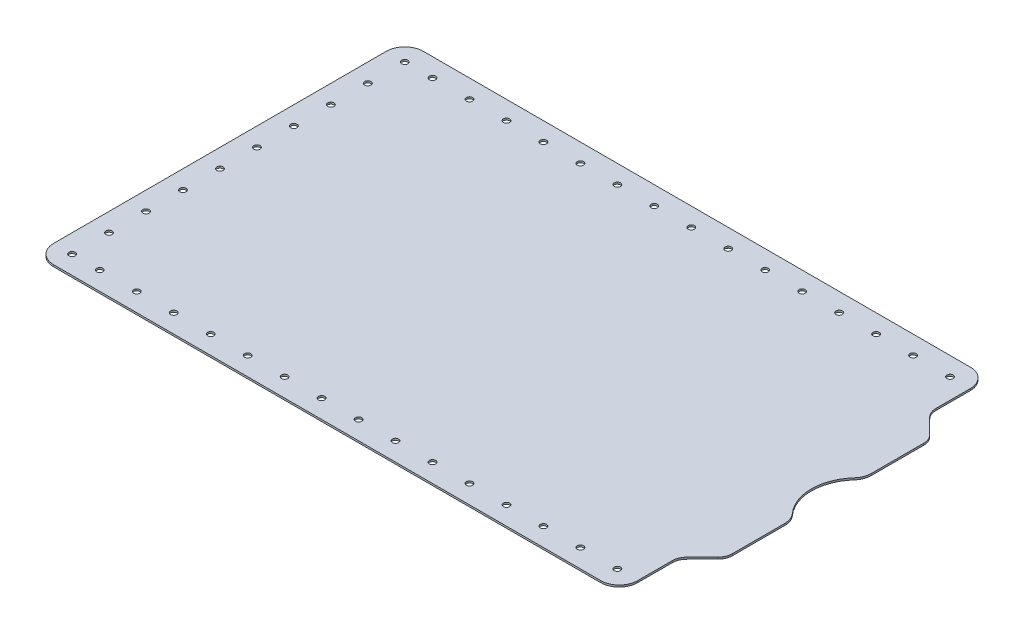
from build123d import *

# Parameters (mm, degrees)
SKETCH1_W                      = 329
SKETCH1_H                      = 200
BOSS_EXTRUDE1_DEPTH            = 1
CUT_EXTRUDE1_DEPTH             = 193.512986575
FILLET1_R                      = 8
FILLET2_R                      = 10
SKETCH3_R                      = 1.7
CUT_EXTRUDE2_DEPTH             = 193.512986575
M3_CLEARANCE_HOLE1_AT_2_COUNT  = 2
M3_CLEARANCE_HOLE1_AT_2_PITCH  = 20
M3_CLEARANCE_HOLE1_AT_3_COUNT  = 2
M3_CLEARANCE_HOLE1_AT_3_PITCH  = 40
M3_CLEARANCE_HOLE1_AT_4_COUNT  = 2
M3_CLEARANCE_HOLE1_AT_4_PITCH  = 60
M3_CLEARANCE_HOLE1_AT_5_COUNT  = 2
M3_CLEARANCE_HOLE1_AT_5_PITCH  = 80
M3_CLEARANCE_HOLE1_AT_6_COUNT  = 2
M3_CLEARANCE_HOLE1_AT_6_PITCH  = 100
M3_CLEARANCE_HOLE1_AT_7_COUNT  = 2
M3_CLEARANCE_HOLE1_AT_7_PITCH  = 120
M3_CLEARANCE_HOLE2_AT_2_COUNT  = 2
M3_CLEARANCE_HOLE2_AT_2_PITCH  = 20
M3_CLEARANCE_HOLE2_AT_3_COUNT  = 2
M3_CLEARANCE_HOLE2_AT_3_PITCH  = 40
M3_CLEARANCE_HOLE2_AT_4_COUNT  = 2
M3_CLEARANCE_HOLE2_AT_4_PITCH  = 60
M3_CLEARANCE_HOLE2_AT_5_COUNT  = 2
M3_CLEARANCE_HOLE2_AT_5_PITCH  = 80
M3_CLEARANCE_HOLE2_AT_6_COUNT  = 2
M3_CLEARANCE_HOLE2_AT_6_PITCH  = 100
M3_CLEARANCE_HOLE2_AT_7_COUNT  = 2
M3_CLEARANCE_HOLE2_AT_7_PITCH  = 120
M3_CLEARANCE_HOLE2_AT_8_COUNT  = 2
M3_CLEARANCE_HOLE2_AT_8_PITCH  = 140
M3_CLEARANCE_HOLE2_AT_9_COUNT  = 2
M3_CLEARANCE_HOLE2_AT_9_PITCH  = 160
M3_CLEARANCE_HOLE2_AT_10_COUNT = 2
M3_CLEARANCE_HOLE2_AT_10_PITCH = 180
M3_CLEARANCE_HOLE2_AT_11_COUNT = 2
M3_CLEARANCE_HOLE2_AT_11_PITCH = 200
M3_CLEARANCE_HOLE2_AT_12_COUNT = 2
M3_CLEARANCE_HOLE2_AT_12_PITCH = 220
M3_CLEARANCE_HOLE2_AT_13_COUNT = 2
M3_CLEARANCE_HOLE2_AT_13_PITCH = 240
M3_CLEARANCE_HOLE2_AT_14_COUNT = 2
M3_CLEARANCE_HOLE2_AT_14_PITCH = 260
M3_CLEARANCE_HOLE2_AT_15_COUNT = 2
M3_CLEARANCE_HOLE2_AT_15_PITCH = 280
M3_CLEARANCE_HOLE2_AT_16_COUNT = 2
M3_CLEARANCE_HOLE2_AT_16_PITCH = 332.866339542
M3_CLEARANCE_HOLE2_AT_17_COUNT = 2
M3_CLEARANCE_HOLE2_AT_17_PITCH = 316.227766017
M3_CLEARANCE_HOLE2_AT_18_COUNT = 2
M3_CLEARANCE_HOLE2_AT_18_PITCH = 300
M3_CLEARANCE_HOLE2_AT_19_COUNT = 2
M3_CLEARANCE_HOLE2_AT_19_PITCH = 284.253408071
M3_CLEARANCE_HOLE2_AT_20_COUNT = 2
M3_CLEARANCE_HOLE2_AT_20_PITCH = 269.072480941
M3_CLEARANCE_HOLE2_AT_21_COUNT = 2
M3_CLEARANCE_HOLE2_AT_21_PITCH = 254.558441227
M3_CLEARANCE_HOLE2_AT_22_COUNT = 2
M3_CLEARANCE_HOLE2_AT_22_PITCH = 240.831891576
M3_CLEARANCE_HOLE2_AT_23_COUNT = 2
M3_CLEARANCE_HOLE2_AT_23_PITCH = 228.03508502
M3_CLEARANCE_HOLE2_AT_24_COUNT = 2
M3_CLEARANCE_HOLE2_AT_24_PITCH = 216.333076528
M3_CLEARANCE_HOLE2_AT_25_COUNT = 2
M3_CLEARANCE_HOLE2_AT_25_PITCH = 205.91260282
M3_CLEARANCE_HOLE2_AT_26_COUNT = 2
M3_CLEARANCE_HOLE2_AT_26_PITCH = 196.977156036
M3_CLEARANCE_HOLE2_AT_27_COUNT = 2
M3_CLEARANCE_HOLE2_AT_27_PITCH = 189.73665961
M3_CLEARANCE_HOLE2_AT_28_COUNT = 2
M3_CLEARANCE_HOLE2_AT_28_PITCH = 184.390889146
M3_CLEARANCE_HOLE2_AT_29_COUNT = 2
M3_CLEARANCE_HOLE2_AT_29_PITCH = 181.107702763
M3_CLEARANCE_HOLE2_AT_30_COUNT = 2
M3_CLEARANCE_HOLE2_AT_30_PITCH = 180
SKETCH9_R                      = 25
CUT_EXTRUDE3_DEPTH             = 10
FILLET3_R                      = 10


with BuildPart() as part:
    # Sketch1 → Boss-Extrude1 (new body)
    with BuildSketch(Plane(origin=(0, 0, 0), x_dir=(1, 0, 0), z_dir=(0, 1, 0))):
        Rectangle(SKETCH1_W, SKETCH1_H)
    extrude(amount=BOSS_EXTRUDE1_DEPTH)

    # Sketch2 → Cut-Extrude1 (cut, through all)
    with BuildSketch(Plane(origin=(0, 0, 0), x_dir=(-1, 0, 0), z_dir=(0, -1, 0))):
        Polygon((-164.5, -55), (-151.5, -68), (-151.5, -100), (-164.5, -100), align=None)
        Polygon((-151.5, 100), (-164.5, 100), (-164.5, 55), (-151.5, 68), align=None)
    extrude(amount=-CUT_EXTRUDE1_DEPTH, mode=Mode.SUBTRACT)

    # Fillet1
    fillet1_edges = [part.edges().sort_by_distance(p)[0] for p in [
        (151.5, 0.5, -68),
        (164.5, 0.5, -55),
        (151.5, 0.5, 68),
        (164.5, 0.5, 55),
    ]]
    fillet(fillet1_edges, radius=FILLET1_R)

    # Fillet2
    fillet2_edges = [part.edges().sort_by_distance(p)[0] for p in [
        (151.5, 0.5, -100),
        (-164.5, 0.5, -100),
        (-164.5, 0.5, 100),
        (151.5, 0.5, 100),
    ]]
    fillet(fillet2_edges, radius=FILLET2_R)

    # Sketch3 → Cut-Extrude2 (cut, through all)
    with BuildSketch(Plane.XZ):
        with Locations((-154.5, -70)):
            Circle(SKETCH3_R)
        with Locations((-154.5, -90)):
            Circle(SKETCH3_R)
        with Locations((-154.5, 70)):
            Circle(SKETCH3_R)
        with Locations((-154.5, 90)):
            Circle(SKETCH3_R)
    extrude(amount=-CUT_EXTRUDE2_DEPTH, mode=Mode.SUBTRACT)

    # Sketch6 → M3 Clearance Hole1 (revolve, cut)
    with BuildSketch(Plane(origin=(-154.5, 0, 70), x_dir=(0, 0, -1), z_dir=(1, 0, 0))):
        Polygon((0, 0), (0, 1), (1.7, 1), (1.7, 0.025), (1.725, 0), align=None)
    m3_clearance_hole1 = revolve(axis=Axis((-154.5, -6.35, 70), (0, 1, 0)), mode=Mode.SUBTRACT)

    # M3 Clearance Hole1 at 2: M3 Clearance Hole1 ×2
    with Locations(*[(0, 0, -i * M3_CLEARANCE_HOLE1_AT_2_PITCH) for i in range(1, M3_CLEARANCE_HOLE1_AT_2_COUNT)]):
        add(m3_clearance_hole1, mode=Mode.SUBTRACT)

    # M3 Clearance Hole1 at 3: M3 Clearance Hole1 ×2
    with Locations(*[(0, 0, -i * M3_CLEARANCE_HOLE1_AT_3_PITCH) for i in range(1, M3_CLEARANCE_HOLE1_AT_3_COUNT)]):
        add(m3_clearance_hole1, mode=Mode.SUBTRACT)

    # M3 Clearance Hole1 at 4: M3 Clearance Hole1 ×2
    with Locations(*[(0, 0, -i * M3_CLEARANCE_HOLE1_AT_4_PITCH) for i in range(1, M3_CLEARANCE_HOLE1_AT_4_COUNT)]):
        add(m3_clearance_hole1, mode=Mode.SUBTRACT)

    # M3 Clearance Hole1 at 5: M3 Clearance Hole1 ×2
    with Locations(*[(0, 0, -i * M3_CLEARANCE_HOLE1_AT_5_PITCH) for i in range(1, M3_CLEARANCE_HOLE1_AT_5_COUNT)]):
        add(m3_clearance_hole1, mode=Mode.SUBTRACT)

    # M3 Clearance Hole1 at 6: M3 Clearance Hole1 ×2
    with Locations(*[(0, 0, -i * M3_CLEARANCE_HOLE1_AT_6_PITCH) for i in range(1, M3_CLEARANCE_HOLE1_AT_6_COUNT)]):
        add(m3_clearance_hole1, mode=Mode.SUBTRACT)

    # M3 Clearance Hole1 at 7: M3 Clearance Hole1 ×2
    with Locations(*[(0, 0, -i * M3_CLEARANCE_HOLE1_AT_7_PITCH) for i in range(1, M3_CLEARANCE_HOLE1_AT_7_COUNT)]):
        add(m3_clearance_hole1, mode=Mode.SUBTRACT)

    # Sketch8 → M3 Clearance Hole2 (revolve, cut)
    with BuildSketch(Plane(origin=(140.5, 0, -90), x_dir=(0, 0, -1), z_dir=(1, 0, 0))):
        Polygon((0, 0), (0, 1), (1.7, 1), (1.7, 0.025), (1.725, 0), align=None)
    m3_clearance_hole2 = revolve(axis=Axis((140.5, -6.35, -90), (0, 1, 0)), mode=Mode.SUBTRACT)

    # M3 Clearance Hole2 at 2: M3 Clearance Hole2 ×2
    with Locations(*[(-i * M3_CLEARANCE_HOLE2_AT_2_PITCH, 0, 0) for i in range(1, M3_CLEARANCE_HOLE2_AT_2_COUNT)]):
        add(m3_clearance_hole2, mode=Mode.SUBTRACT)

    # M3 Clearance Hole2 at 3: M3 Clearance Hole2 ×2
    with Locations(*[(-i * M3_CLEARANCE_HOLE2_AT_3_PITCH, 0, 0) for i in range(1, M3_CLEARANCE_HOLE2_AT_3_COUNT)]):
        add(m3_clearance_hole2, mode=Mode.SUBTRACT)

    # M3 Clearance Hole2 at 4: M3 Clearance Hole2 ×2
    with Locations(*[(-i * M3_CLEARANCE_HOLE2_AT_4_PITCH, 0, 0) for i in range(1, M3_CLEARANCE_HOLE2_AT_4_COUNT)]):
        add(m3_clearance_hole2, mode=Mode.SUBTRACT)

    # M3 Clearance Hole2 at 5: M3 Clearance Hole2 ×2
    with Locations(*[(-i * M3_CLEARANCE_HOLE2_AT_5_PITCH, 0, 0) for i in range(1, M3_CLEARANCE_HOLE2_AT_5_COUNT)]):
        add(m3_clearance_hole2, mode=Mode.SUBTRACT)

    # M3 Clearance Hole2 at 6: M3 Clearance Hole2 ×2
    with Locations(*[(-i * M3_CLEARANCE_HOLE2_AT_6_PITCH, 0, 0) for i in range(1, M3_CLEARANCE_HOLE2_AT_6_COUNT)]):
        add(m3_clearance_hole2, mode=Mode.SUBTRACT)

    # M3 Clearance Hole2 at 7: M3 Clearance Hole2 ×2
    with Locations(*[(-i * M3_CLEARANCE_HOLE2_AT_7_PITCH, 0, 0) for i in range(1, M3_CLEARANCE_HOLE2_AT_7_COUNT)]):
        add(m3_clearance_hole2, mode=Mode.SUBTRACT)

    # M3 Clearance Hole2 at 8: M3 Clearance Hole2 ×2
    with Locations(*[(-i * M3_CLEARANCE_HOLE2_AT_8_PITCH, 0, 0) for i in range(1, M3_CLEARANCE_HOLE2_AT_8_COUNT)]):
        add(m3_clearance_hole2, mode=Mode.SUBTRACT)

    # M3 Clearance Hole2 at 9: M3 Clearance Hole2 ×2
    with Locations(*[(-i * M3_CLEARANCE_HOLE2_AT_9_PITCH, 0, 0) for i in range(1, M3_CLEARANCE_HOLE2_AT_9_COUNT)]):
        add(m3_clearance_hole2, mode=Mode.SUBTRACT)

    # M3 Clearance Hole2 at 10: M3 Clearance Hole2 ×2
    with Locations(*[(-i * M3_CLEARANCE_HOLE2_AT_10_PITCH, 0, 0) for i in range(1, M3_CLEARANCE_HOLE2_AT_10_COUNT)]):
        add(m3_clearance_hole2, mode=Mode.SUBTRACT)

    # M3 Clearance Hole2 at 11: M3 Clearance Hole2 ×2
    with Locations(*[(-i * M3_CLEARANCE_HOLE2_AT_11_PITCH, 0, 0) for i in range(1, M3_CLEARANCE_HOLE2_AT_11_COUNT)]):
        add(m3_clearance_hole2, mode=Mode.SUBTRACT)

    # M3 Clearance Hole2 at 12: M3 Clearance Hole2 ×2
    with Locations(*[(-i * M3_CLEARANCE_HOLE2_AT_12_PITCH, 0, 0) for i in range(1, M3_CLEARANCE_HOLE2_AT_12_COUNT)]):
        add(m3_clearance_hole2, mode=Mode.SUBTRACT)

    # M3 Clearance Hole2 at 13: M3 Clearance Hole2 ×2
    with Locations(*[(-i * M3_CLEARANCE_HOLE2_AT_13_PITCH, 0, 0) for i in range(1, M3_CLEARANCE_HOLE2_AT_13_COUNT)]):
        add(m3_clearance_hole2, mode=Mode.SUBTRACT)

    # M3 Clearance Hole2 at 14: M3 Clearance Hole2 ×2
    with Locations(*[(-i * M3_CLEARANCE_HOLE2_AT_14_PITCH, 0, 0) for i in range(1, M3_CLEARANCE_HOLE2_AT_14_COUNT)]):
        add(m3_clearance_hole2, mode=Mode.SUBTRACT)

    # M3 Clearance Hole2 at 15: M3 Clearance Hole2 ×2
    with Locations(*[(-i * M3_CLEARANCE_HOLE2_AT_15_PITCH, 0, 0) for i in range(1, M3_CLEARANCE_HOLE2_AT_15_COUNT)]):
        add(m3_clearance_hole2, mode=Mode.SUBTRACT)

    # M3 Clearance Hole2 at 16: M3 Clearance Hole2 ×2
    with Locations(*[Vector(-0.8411784753765535, 0, 0.5407575913134988) * (i * M3_CLEARANCE_HOLE2_AT_16_PITCH) for i in range(1, M3_CLEARANCE_HOLE2_AT_16_COUNT)]):
        add(m3_clearance_hole2, mode=Mode.SUBTRACT)

    # M3 Clearance Hole2 at 17: M3 Clearance Hole2 ×2
    with Locations(*[Vector(-0.8221921916437787, 0, 0.5692099788303084) * (i * M3_CLEARANCE_HOLE2_AT_17_PITCH) for i in range(1, M3_CLEARANCE_HOLE2_AT_17_COUNT)]):
        add(m3_clearance_hole2, mode=Mode.SUBTRACT)

    # M3 Clearance Hole2 at 18: M3 Clearance Hole2 ×2
    with Locations(*[Vector(-0.8, 0, 0.6000000000000001) * (i * M3_CLEARANCE_HOLE2_AT_18_PITCH) for i in range(1, M3_CLEARANCE_HOLE2_AT_18_COUNT)]):
        add(m3_clearance_hole2, mode=Mode.SUBTRACT)

    # M3 Clearance Hole2 at 19: M3 Clearance Hole2 ×2
    with Locations(*[Vector(-0.773957299203321, 0, 0.6332377902572627) * (i * M3_CLEARANCE_HOLE2_AT_19_PITCH) for i in range(1, M3_CLEARANCE_HOLE2_AT_19_COUNT)]):
        add(m3_clearance_hole2, mode=Mode.SUBTRACT)

    # M3 Clearance Hole2 at 20: M3 Clearance Hole2 ×2
    with Locations(*[Vector(-0.7432941462471663, 0, 0.6689647316224497) * (i * M3_CLEARANCE_HOLE2_AT_20_PITCH) for i in range(1, M3_CLEARANCE_HOLE2_AT_20_COUNT)]):
        add(m3_clearance_hole2, mode=Mode.SUBTRACT)

    # M3 Clearance Hole2 at 21: M3 Clearance Hole2 ×2
    with Locations(*[Vector(-0.7071067811865475, 0, 0.7071067811865476) * (i * M3_CLEARANCE_HOLE2_AT_21_PITCH) for i in range(1, M3_CLEARANCE_HOLE2_AT_21_COUNT)]):
        add(m3_clearance_hole2, mode=Mode.SUBTRACT)

    # M3 Clearance Hole2 at 22: M3 Clearance Hole2 ×2
    with Locations(*[Vector(-0.6643638388299197, 0, 0.7474093186836598) * (i * M3_CLEARANCE_HOLE2_AT_22_PITCH) for i in range(1, M3_CLEARANCE_HOLE2_AT_22_COUNT)]):
        add(m3_clearance_hole2, mode=Mode.SUBTRACT)

    # M3 Clearance Hole2 at 23: M3 Clearance Hole2 ×2
    with Locations(*[Vector(-0.6139406135149205, 0, 0.7893522173763263) * (i * M3_CLEARANCE_HOLE2_AT_23_PITCH) for i in range(1, M3_CLEARANCE_HOLE2_AT_23_COUNT)]):
        add(m3_clearance_hole2, mode=Mode.SUBTRACT)

    # M3 Clearance Hole2 at 24: M3 Clearance Hole2 ×2
    with Locations(*[Vector(-0.554700196225229, 0, 0.8320502943378437) * (i * M3_CLEARANCE_HOLE2_AT_24_PITCH) for i in range(1, M3_CLEARANCE_HOLE2_AT_24_COUNT)]):
        add(m3_clearance_hole2, mode=Mode.SUBTRACT)

    # M3 Clearance Hole2 at 25: M3 Clearance Hole2 ×2
    with Locations(*[Vector(-0.48564293117863216, 0, 0.8741572761215377) * (i * M3_CLEARANCE_HOLE2_AT_25_PITCH) for i in range(1, M3_CLEARANCE_HOLE2_AT_25_COUNT)]):
        add(m3_clearance_hole2, mode=Mode.SUBTRACT)

    # M3 Clearance Hole2 at 26: M3 Clearance Hole2 ×2
    with Locations(*[Vector(-0.4061384660534476, 0, 0.9138115486202572) * (i * M3_CLEARANCE_HOLE2_AT_26_PITCH) for i in range(1, M3_CLEARANCE_HOLE2_AT_26_COUNT)]):
        add(m3_clearance_hole2, mode=Mode.SUBTRACT)

    # M3 Clearance Hole2 at 27: M3 Clearance Hole2 ×2
    with Locations(*[Vector(-0.316227766016838, 0, 0.9486832980505139) * (i * M3_CLEARANCE_HOLE2_AT_27_PITCH) for i in range(1, M3_CLEARANCE_HOLE2_AT_27_COUNT)]):
        add(m3_clearance_hole2, mode=Mode.SUBTRACT)

    # M3 Clearance Hole2 at 28: M3 Clearance Hole2 ×2
    with Locations(*[Vector(-0.2169304578186562, 0, 0.9761870601839527) * (i * M3_CLEARANCE_HOLE2_AT_28_PITCH) for i in range(1, M3_CLEARANCE_HOLE2_AT_28_COUNT)]):
        add(m3_clearance_hole2, mode=Mode.SUBTRACT)

    # M3 Clearance Hole2 at 29: M3 Clearance Hole2 ×2
    with Locations(*[Vector(-0.11043152607484662, 0, 0.9938837346736189) * (i * M3_CLEARANCE_HOLE2_AT_29_PITCH) for i in range(1, M3_CLEARANCE_HOLE2_AT_29_COUNT)]):
        add(m3_clearance_hole2, mode=Mode.SUBTRACT)

    # M3 Clearance Hole2 at 30: M3 Clearance Hole2 ×2
    with Locations(*[(0, 0, i * M3_CLEARANCE_HOLE2_AT_30_PITCH) for i in range(1, M3_CLEARANCE_HOLE2_AT_30_COUNT)]):
        add(m3_clearance_hole2, mode=Mode.SUBTRACT)

    # Sketch9 → Cut-Extrude3 (cut)
    with BuildSketch(Plane(origin=(0, 0, 0), x_dir=(-1, 0, 0), z_dir=(0, -1, 0))):
        with Locations((-180.5, 0)):
            Circle(SKETCH9_R)
    extrude(amount=-CUT_EXTRUDE3_DEPTH, mode=Mode.SUBTRACT)

    # Fillet3
    fillet3_edges = [part.edges().sort_by_distance(p)[0] for p in [
        (164.5, 0.5, -19.209372712),
        (164.5, 0.5, 19.209372712),
    ]]
    fillet(fillet3_edges, radius=FILLET3_R)


solid = part.part
